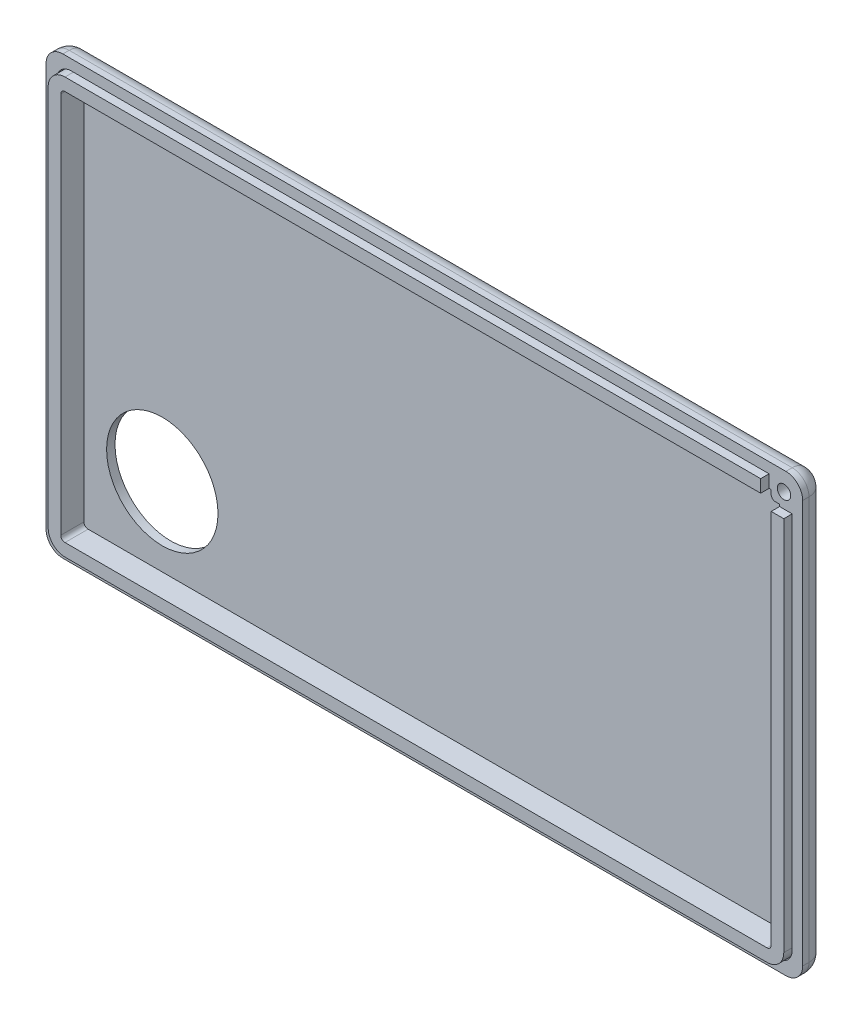
from build123d import *
from OCP.BRepFilletAPI import BRepFilletAPI_MakeChamfer

# Parameters (mm, degrees)
SKETCH1_W            = 180
SKETCH1_H            = 120
BOSS_EXTRUDE1_DEPTH  = 20
BOSS_EXTRUDE2_DEPTH  = 180
SHELL3_T             = -2
FILLET1_R            = 4
FILLET2_R            = 4
BOSS_EXTRUDE3_DEPTH  = 2.5
SKETCH14_R           = 1.6
CUT_EXTRUDE10_DEPTH  = 3.2
CUT_EXTRUDE3_REACH   = 151.991
SKETCH7_W            = 14
SKETCH7_H            = 9
SKETCH8_R            = 1.35
BOSS_EXTRUDE4_DEPTH  = 5
SKETCH8_3_W          = 97.5
SKETCH8_3_H          = 40.5
CUT_EXTRUDE4_DEPTH   = 5
SKETCH9_W            = 50.8
SKETCH9_H            = 19.5
CUT_EXTRUDE5_DEPTH   = 5
SKETCH10_R           = 2.525
CUT_EXTRUDE6_DEPTH   = 5
SKETCH11_R           = 6.125
CUT_EXTRUDE7_DEPTH   = 5
CUT_EXTRUDE8_DEPTH   = 5
FILLET4_R            = 1.5
SKETCH13_W           = 22
SKETCH13_H           = 10
CUT_EXTRUDE9_DEPTH   = 5
CHAMFER1_SIZE        = 9.330127019
CHAMFER1_SIZE_2      = 2.5
SKETCH15_W           = 9
SKETCH15_H           = 14
CUT_EXTRUDE11_DEPTH  = 3.2
SKETCH16_R           = 3.5
CUT_EXTRUDE12_DEPTH  = 3.2
SKETCH17_R           = 7
SKETCH17_R_2         = 6
BOSS_EXTRUDE5_DEPTH  = 0.5
FILLET7_R            = 0.5
CUT_EXTRUDE13_DEPTH  = 1
FILLET8_R            = 1
SKETCH19_W           = 7.5
SKETCH19_H           = 5.2
SKETCH19_W_2         = 6.5
SKETCH19_H_2         = 6.5
CUT_EXTRUDE14_DEPTH  = 1.2
BOSS_EXTRUDE6_START  = 4
BOSS_EXTRUDE6_DEPTH  = 4
BOSS_EXTRUDE7_START  = 2
BOSS_EXTRUDE7_DEPTH  = 2
FILLET9_R            = 4
CUT_EXTRUDE18_REACH  = 220.067
BOSS_EXTRUDE8_DEPTH  = 3.5
BOSS_EXTRUDE10_DEPTH = 5.5
BOSS_EXTRUDE12_START = -3.5
BOSS_EXTRUDE12_DEPTH = 3.5
CUT_EXTRUDE21_DEPTH  = 54
SKETCH31_R           = 1.6
CUT_EXTRUDE22_DEPTH  = 54
FILLET11_R           = 1
SKETCH32_R           = 13.25
CUT_EXTRUDE23_DEPTH  = 10


# Read off the part's stored shape, not the designer's step: Boss-Extrude12
with BuildPart() as part:
    # Sketch1 → Boss-Extrude1 (new body)
    with BuildSketch(Plane(origin=(0, 0, 0), x_dir=(1, 0, 0), z_dir=(0, 1, 0))):
        Rectangle(SKETCH1_W, SKETCH1_H)
    extrude(amount=BOSS_EXTRUDE1_DEPTH)

    # Sketch2 → Boss-Extrude2 (add)
    with BuildSketch(Plane.ZY.offset(90)):
        Polygon((60, 20), (-40, 103.909963118), (-60, 103.909963118), (-60, 20), align=None)
    extrude(amount=-BOSS_EXTRUDE2_DEPTH)

    # Shell3
    shell3_openings = [part.faces().sort_by_distance(p)[0] for p in [
        (0, 51.954981559, -60),
    ]]
    offset(amount=SHELL3_T, openings=shell3_openings, kind=Kind.INTERSECTION)

    # Fillet1
    fillet1_edges = [part.edges().sort_by_distance(p)[0] for p in [
        (0, 20, 60),
        (0, 103.909963118, -40),
        (-90, 61.954981559, 10),
        (-90, 103.909963118, -50),
        (90, 103.909963118, -50),
        (90, 61.954981559, 10),
        (0, 0, 60),
        (-90, 0, 0),
        (90, 0, 0),
        (90, 10, 60),
        (-90, 10, 60),
    ]]
    fillet(fillet1_edges, radius=FILLET1_R)

    # Fillet2
    fillet2_edges = [part.edges().sort_by_distance(p)[0] for p in [
        (88, 2, -1),
        (88, 101.909963118, -50.363970234),
        (88, 60.488673901, 8.636029766),
        (88, 10.533692342, 58),
        (-88, 2, -1),
        (-88, 60.488673901, 8.636029766),
        (-88, 101.909963118, -50.363970234),
        (0, 2, 58),
        (-88, 10.533692342, 58),
        (0, 101.909963118, -40.727940469),
        (0, 19.067384684, 58),
    ]]
    fillet(fillet2_edges, radius=FILLET2_R)

    # Sketch4 → Boss-Extrude3 (add)
    with BuildSketch(Plane(origin=(0, 2, 0), x_dir=(1, 0, 0), z_dir=(0, 1, 0))):
        Polygon((34.175426481, -3.50047313), (32.58771324, -0.75047313), (29.41228676, -0.75047313), (27.824573519, -3.50047313), (29.41228676, -6.25047313), (32.58771324, -6.25047313), align=None)
        Polygon((32.58771324, 41.24952687), (34.175426481, 38.49952687), (32.58771324, 35.74952687), (29.41228676, 35.74952687), (27.824573519, 38.49952687), (29.41228676, 41.24952687), align=None)
        Polygon((-29.41228676, 41.24952687), (-32.58771324, 41.24952687), (-34.175426481, 38.49952687), (-32.58771324, 35.74952687), (-29.41228676, 35.74952687), (-27.824573519, 38.49952687), align=None)
        Polygon((-32.58771324, -6.25047313), (-34.175426481, -3.50047313), (-32.58771324, -0.75047313), (-29.41228676, -0.75047313), (-27.824573519, -3.50047313), (-29.41228676, -6.25047313), align=None)
    extrude(amount=BOSS_EXTRUDE3_DEPTH)

    # Sketch14 → Cut-Extrude10 (cut)
    with BuildSketch(Plane(origin=(0, 4.5, 0), x_dir=(1, 0, 0), z_dir=(0, 1, 0))):
        with Locations(Location((31, 38.49952687, 0), (0, 0, 270))):
            Circle(SKETCH14_R)
        with Locations(Location((-31, -3.50047313, 0), (0, 0, 90))):
            Circle(SKETCH14_R)
        with Locations(Location((-31, 38.49952687, 0), (0, 0, 270))):
            Circle(SKETCH14_R)
        with Locations(Location((31, -3.50047313, 0), (0, 0, 270))):
            Circle(SKETCH14_R)
    extrude(amount=-CUT_EXTRUDE10_DEPTH, mode=Mode.SUBTRACT)

    # Sketch7 → Cut-Extrude3 (cut, up to next)
    with BuildSketch(Plane(origin=(0, 103.909963118, 0), x_dir=(1, 0, 0), z_dir=(0, 1, 0)), mode=Mode.PRIVATE) as cut_extrude3_sk1:
        with Locations((-63, 50.727940469)):
            Rectangle(SKETCH7_W, SKETCH7_H)
    cut_extrude3_tool1 = extrude(cut_extrude3_sk1.sketch, amount=-CUT_EXTRUDE3_REACH, mode=Mode.PRIVATE) & part.part
    add(cut_extrude3_tool1.solids().sort_by_distance((-63, 103.909963, -50.72794))[0], mode=Mode.SUBTRACT)

    # Sketch8 → Boss-Extrude4 (add)
    with BuildSketch(Plane(origin=(0, 41.280714367, 34.6386322), x_dir=(1, 0, 0), z_dir=(0, 0.766044443118982, 0.6427876096865347))):
        with Locations(Location((-73.5, 93.477933603, 0), (0, 0, 270))):
            Circle(SKETCH8_R)
        with Locations(Location((-73.5, 37.977933603, 0), (0, 0, 270))):
            Circle(SKETCH8_R)
        with Locations(Location((19, 37.977933603, 0), (0, 0, 270))):
            Circle(SKETCH8_R)
        with Locations(Location((19, 93.477933603, 0), (0, 0, 270))):
            Circle(SKETCH8_R)
    extrude(amount=-BOSS_EXTRUDE4_DEPTH)

    # Sketch8<3> → Cut-Extrude4 (cut)
    with BuildSketch(Plane(origin=(0, 41.280714367, 34.6386322), x_dir=(1, 0, 0), z_dir=(0, 0.766044443118982, 0.6427876096865347))):
        with Locations((-27.25, 65.727933603)):
            Rectangle(SKETCH8_3_W, SKETCH8_3_H)
    extrude(amount=-CUT_EXTRUDE4_DEPTH, mode=Mode.SUBTRACT)

    # Sketch9 → Cut-Extrude5 (cut)
    with BuildSketch(Plane(origin=(0, 41.280714367, 34.6386322), x_dir=(1, 0, 0), z_dir=(0, 0.766044443118982, 0.6427876096865347))):
        with Locations((-50.6, 20.727933603)):
            Rectangle(SKETCH9_W, SKETCH9_H)
    extrude(amount=-CUT_EXTRUDE5_DEPTH, mode=Mode.SUBTRACT)

    # Sketch10 → Cut-Extrude6 (cut)
    with BuildSketch(Plane(origin=(0, 41.280714367, 34.6386322), x_dir=(1, 0, 0), z_dir=(0, 0.766044443118982, 0.6427876096865347))):
        with Locations(Location((-13.525, 20.727933603, 0), (0, 0, 270))):
            Circle(SKETCH10_R)
        with Locations(Location((-1.85, 20.727933603, 0), (0, 0, 270))):
            Circle(SKETCH10_R)
        with Locations(Location((9.825, 20.727933603, 0), (0, 0, 270))):
            Circle(SKETCH10_R)
    extrude(amount=-CUT_EXTRUDE6_DEPTH, mode=Mode.SUBTRACT)

    # Sketch11 → Cut-Extrude7 (cut)
    with BuildSketch(Plane(origin=(0, 41.280714367, 34.6386322), x_dir=(1, 0, 0), z_dir=(0, 0.766044443118982, 0.6427876096865347))):
        with Locations(Location((37.625, 60.977933603, 0), (0, 0, 270))):
            Circle(SKETCH11_R)
        with BuildLine():
            ThreePointArc((76, 60.977933603), (74.206029035, 65.308962638), (69.875, 67.102933603))
            Line((69.875, 67.102933603), (69.875, 54.852933603))
            ThreePointArc((69.875, 54.852933603), (74.206029035, 56.646904568), (76, 60.977933603))
        make_face()
        with BuildLine():
            Line((69.875, 54.852933603), (69.875, 67.102933603))
            ThreePointArc((69.875, 67.102933603), (63.75, 60.977933603), (69.875, 54.852933603))
        make_face()
    extrude(amount=-CUT_EXTRUDE7_DEPTH, mode=Mode.SUBTRACT)

    # Sketch12 → Cut-Extrude8 (cut)
    with BuildSketch(Plane(origin=(0, 41.280714367, 34.6386322), x_dir=(1, 0, 0), z_dir=(0, 0.766044443118982, 0.6427876096865347))):
        with BuildLine():
            ThreePointArc((-76, -10.131875079), (-66, -20.131875079), (-56, -10.131875079))
            Line((-56, -10.131875079), (-76, -10.131875079))
        make_face()
        with BuildLine():
            Line((-76, -10.131875079), (-56, -10.131875079))
            ThreePointArc((-56, -10.131875079), (-66, -0.131875079), (-76, -10.131875079))
        make_face()
        with BuildLine():
            ThreePointArc((-25.2, -10.131875079), (-35.2, -0.131875079), (-45.2, -10.131875079))
            Line((-45.2, -10.131875079), (-25.2, -10.131875079))
        make_face()
        with BuildLine():
            Line((-25.2, -10.131875079), (-45.2, -10.131875079))
            ThreePointArc((-45.2, -10.131875079), (-35.2, -20.131875079), (-25.2, -10.131875079))
        make_face()
    extrude(amount=-CUT_EXTRUDE8_DEPTH, mode=Mode.SUBTRACT)

    # Fillet4
    fillet4_edges = [part.edges().sort_by_distance(p)[0] for p in [
        (-45.2, 33.235981717, 41.114523583),
        (-76, 33.235981717, 41.114523583),
    ]]
    fillet(fillet4_edges, radius=FILLET4_R)

    # Sketch13 → Cut-Extrude9 (cut)
    with BuildSketch(Plane(origin=(0, 41.280714367, 34.6386322), x_dir=(1, 0, 0), z_dir=(0, 0.766044443118982, 0.6427876096865347))):
        with Locations((-1.85, -0.131875079)):
            Rectangle(SKETCH13_W, SKETCH13_H)
        with Locations((-1.85, -20.131875079)):
            Rectangle(SKETCH13_W, SKETCH13_H)
    extrude(amount=-CUT_EXTRUDE9_DEPTH, mode=Mode.SUBTRACT)

    # Chamfer1
    chamfer1_edges_1 = [part.edges().sort_by_distance(p)[0] for p in [
        (-28.61843014, 2, 4.87547313),
    ]]
    chamfer1_side_1 = [part.faces().sort_by_distance(p)[0] for p in [
        (-28.575128869, 2, 4.90047313),
    ]]
    chamfer1_edges_2 = [part.edges().sort_by_distance(p)[0] for p in [
        (-31, 2, 6.25047313),
    ]]
    chamfer1_side_2 = [part.faces().sort_by_distance(p)[0] for p in [
        (-31, 2, 6.30047313),
    ]]
    chamfer1_edges_3 = [part.edges().sort_by_distance(p)[0] for p in [
        (-33.38156986, 2, 4.87547313),
    ]]
    chamfer1_side_3 = [part.faces().sort_by_distance(p)[0] for p in [
        (-33.424871131, 2, 4.90047313),
    ]]
    chamfer1_edges_4 = [part.edges().sort_by_distance(p)[0] for p in [
        (-33.38156986, 2, -37.12452687),
    ]]
    chamfer1_side_4 = [part.faces().sort_by_distance(p)[0] for p in [
        (-33.424871131, 2, -37.09952687),
    ]]
    chamfer1_edges_5 = [part.edges().sort_by_distance(p)[0] for p in [
        (-31, 2, -35.74952687),
    ]]
    chamfer1_side_5 = [part.faces().sort_by_distance(p)[0] for p in [
        (-31, 2, -35.69952687),
    ]]
    chamfer1_edges_6 = [part.edges().sort_by_distance(p)[0] for p in [
        (-28.61843014, 2, -37.12452687),
    ]]
    chamfer1_side_6 = [part.faces().sort_by_distance(p)[0] for p in [
        (-28.575128869, 2, -37.09952687),
    ]]
    chamfer1_edges_7 = [part.edges().sort_by_distance(p)[0] for p in [
        (28.61843014, 2, -37.12452687),
    ]]
    chamfer1_side_7 = [part.faces().sort_by_distance(p)[0] for p in [
        (28.575128869, 2, -37.09952687),
    ]]
    chamfer1_edges_8 = [part.edges().sort_by_distance(p)[0] for p in [
        (31, 2, -35.74952687),
    ]]
    chamfer1_side_8 = [part.faces().sort_by_distance(p)[0] for p in [
        (31, 2, -35.69952687),
    ]]
    chamfer1_edges_9 = [part.edges().sort_by_distance(p)[0] for p in [
        (33.38156986, 2, -37.12452687),
    ]]
    chamfer1_side_9 = [part.faces().sort_by_distance(p)[0] for p in [
        (33.424871131, 2, -37.09952687),
    ]]
    chamfer1_edges_10 = [part.edges().sort_by_distance(p)[0] for p in [
        (33.38156986, 2, 4.87547313),
    ]]
    chamfer1_side_10 = [part.faces().sort_by_distance(p)[0] for p in [
        (33.424871131, 2, 4.90047313),
    ]]
    chamfer1_edges_11 = [part.edges().sort_by_distance(p)[0] for p in [
        (28.61843014, 2, 4.87547313),
    ]]
    chamfer1_side_11 = [part.faces().sort_by_distance(p)[0] for p in [
        (28.575128869, 2, 4.90047313),
    ]]
    chamfer1_edges_12 = [part.edges().sort_by_distance(p)[0] for p in [
        (31, 2, 6.25047313),
    ]]
    chamfer1_side_12 = [part.faces().sort_by_distance(p)[0] for p in [
        (31, 2, 6.30047313),
    ]]
    chamfer1 = BRepFilletAPI_MakeChamfer(part.part.solid().wrapped)
    for e in chamfer1_edges_1:
        chamfer1.Add(CHAMFER1_SIZE - 0.0001, CHAMFER1_SIZE_2 - 0.0001, e.wrapped, chamfer1_side_1[0].wrapped)
    for e in chamfer1_edges_2:
        chamfer1.Add(CHAMFER1_SIZE - 0.0001, CHAMFER1_SIZE_2 - 0.0001, e.wrapped, chamfer1_side_2[0].wrapped)
    for e in chamfer1_edges_3:
        chamfer1.Add(CHAMFER1_SIZE - 0.0001, CHAMFER1_SIZE_2 - 0.0001, e.wrapped, chamfer1_side_3[0].wrapped)
    for e in chamfer1_edges_4:
        chamfer1.Add(CHAMFER1_SIZE - 0.0001, CHAMFER1_SIZE_2 - 0.0001, e.wrapped, chamfer1_side_4[0].wrapped)
    for e in chamfer1_edges_5:
        chamfer1.Add(CHAMFER1_SIZE - 0.0001, CHAMFER1_SIZE_2 - 0.0001, e.wrapped, chamfer1_side_5[0].wrapped)
    for e in chamfer1_edges_6:
        chamfer1.Add(CHAMFER1_SIZE - 0.0001, CHAMFER1_SIZE_2 - 0.0001, e.wrapped, chamfer1_side_6[0].wrapped)
    for e in chamfer1_edges_7:
        chamfer1.Add(CHAMFER1_SIZE - 0.0001, CHAMFER1_SIZE_2 - 0.0001, e.wrapped, chamfer1_side_7[0].wrapped)
    for e in chamfer1_edges_8:
        chamfer1.Add(CHAMFER1_SIZE - 0.0001, CHAMFER1_SIZE_2 - 0.0001, e.wrapped, chamfer1_side_8[0].wrapped)
    for e in chamfer1_edges_9:
        chamfer1.Add(CHAMFER1_SIZE - 0.0001, CHAMFER1_SIZE_2 - 0.0001, e.wrapped, chamfer1_side_9[0].wrapped)
    for e in chamfer1_edges_10:
        chamfer1.Add(CHAMFER1_SIZE - 0.0001, CHAMFER1_SIZE_2 - 0.0001, e.wrapped, chamfer1_side_10[0].wrapped)
    for e in chamfer1_edges_11:
        chamfer1.Add(CHAMFER1_SIZE - 0.0001, CHAMFER1_SIZE_2 - 0.0001, e.wrapped, chamfer1_side_11[0].wrapped)
    for e in chamfer1_edges_12:
        chamfer1.Add(CHAMFER1_SIZE - 0.0001, CHAMFER1_SIZE_2 - 0.0001, e.wrapped, chamfer1_side_12[0].wrapped)
    add(Compound.cast(chamfer1.Shape()), mode=Mode.REPLACE)  # a hair under: the kernel refuses the full size

    # Sketch15 → Cut-Extrude11 (cut)
    with BuildSketch(Plane(origin=(0, 41.280714367, 34.6386322), x_dir=(1, 0, 0), z_dir=(0, 0.766044443118982, 0.6427876096865347))):
        with Locations((69.812284425, 22.683898911)):
            Rectangle(SKETCH15_W, SKETCH15_H)
        with Locations((53.870194494, 22.738966801)):
            Rectangle(SKETCH15_W, SKETCH15_H)
        with Locations((37.689197041, 22.832961961)):
            Rectangle(SKETCH15_W, SKETCH15_H)
    extrude(amount=-CUT_EXTRUDE11_DEPTH, mode=Mode.SUBTRACT)

    # Sketch16 → Cut-Extrude12 (cut)
    with BuildSketch(Plane(origin=(0, 41.280714367, 34.6386322), x_dir=(1, 0, 0), z_dir=(0, 0.766044443118982, 0.6427876096865347))):
        with Locations(Location((66.7875, -10.131875079, 0), (0, 0, 270))):
            Circle(SKETCH16_R)
        with Locations(Location((28.150317304, -10.131875079, 0), (0, 0, 270))):
            Circle(SKETCH16_R)
        with Locations(Location((47.575, -10.131875079, 0), (0, 0, 270))):
            Circle(SKETCH16_R)
    extrude(amount=-CUT_EXTRUDE12_DEPTH, mode=Mode.SUBTRACT)

    # Sketch17 → Boss-Extrude5 (add)
    # profile 1 of 4: a face of its own
    with BuildSketch(Plane.XZ):
        with Locations(Location((-78.221825407, 48.221825407, 0), (0, 0, 270))):
            Circle(SKETCH17_R)
        with Locations(Location((-78.221825407, 48.221825407, 0), (0, 0, 270))):
            Circle(SKETCH17_R_2, mode=Mode.SUBTRACT)
    # profile 2 of 4: a face of its own
    with BuildSketch(Plane.XZ):
        with Locations(Location((78.221825407, 48.221825407, 0), (0, 0, 270))):
            Circle(SKETCH17_R)
        with Locations(Location((78.221825407, 48.221825407, 0), (0, 0, 270))):
            Circle(SKETCH17_R_2, mode=Mode.SUBTRACT)
    # profile 3 of 4: a face of its own
    with BuildSketch(Plane.XZ):
        with Locations(Location((78.221825407, -51.278809632, 0), (0, 0, 270))):
            Circle(SKETCH17_R)
        with Locations(Location((78.221825407, -51.278809632, 0), (0, 0, 270))):
            Circle(SKETCH17_R_2, mode=Mode.SUBTRACT)
    # profile 4 of 4: a face of its own
    with BuildSketch(Plane.XZ):
        with Locations(Location((-78.221825407, -51.278809632, 0), (0, 0, 270))):
            Circle(SKETCH17_R)
        with Locations(Location((-78.221825407, -51.278809632, 0), (0, 0, 270))):
            Circle(SKETCH17_R_2, mode=Mode.SUBTRACT)
    extrude(amount=BOSS_EXTRUDE5_DEPTH)

    # Fillet7
    fillet7_edges = [part.edges().sort_by_distance(p)[0] for p in [
        (78.221825407, -0.5, -45.278809632),
        (78.221825407, -0.5, -44.278809632),
        (78.221825407, -0.5, 55.221825407),
        (78.221825407, -0.5, 54.221825407),
        (-78.221825407, -0.5, 54.221825407),
        (-78.221825407, -0.5, 55.221825407),
        (-78.221825407, -0.5, -44.278809632),
        (-78.221825407, -0.5, -45.278809632),
    ]]
    fillet(fillet7_edges, radius=FILLET7_R - 0.0001)  # a hair under: the kernel refuses the full size

    # Sketch18 → Cut-Extrude13 (cut)
    with BuildSketch(Plane.XZ.offset(-101.909963118)):
        Polygon((-51, -58), (79, -58), (79, -44.183821406), (-51, -44.183821406), (-51, -50.727940469), align=None)
    extrude(amount=-CUT_EXTRUDE13_DEPTH, mode=Mode.SUBTRACT)

    # Fillet8
    fillet8_edges = [part.edges().sort_by_distance(p)[0] for p in [
        (-51, 102.909963118, -51.091910703),
        (14, 102.909963118, -44.183821406),
        (79, 102.909963118, -51.091910703),
        (14, 102.909963118, -58),
    ]]
    fillet(fillet8_edges, radius=FILLET8_R - 0.0001)  # a hair under: the kernel refuses the full size

    # Sketch19 → Cut-Extrude14 (cut)
    with BuildSketch(Plane(origin=(0, 103.909963118, 0), x_dir=(1, 0, 0), z_dir=(0, 1, 0))):
        with Locations((-42.25, 50.727940469)):
            Rectangle(SKETCH19_W, SKETCH19_H)
        with Locations((-32.25, 50.727940469)):
            Rectangle(SKETCH19_W_2, SKETCH19_H_2)
        Polygon((-14, 50.727940469), (-14, 53.227940469), (74.4, 53.227940469), (74.4, 48.227940469), (-14, 48.227940469), align=None)
    extrude(amount=-CUT_EXTRUDE14_DEPTH, mode=Mode.SUBTRACT)

    # Sketch20 → Boss-Extrude6 (add)
    with BuildSketch(Plane(origin=(0, 0, -60), x_dir=(-1, 0, 0), z_dir=(0, 0, -1)).offset(BOSS_EXTRUDE6_START)):
        with BuildLine():
            Line((-86, 103.909963118), (86, 103.909963118))
            ThreePointArc((86, 103.909963118), (88.828427125, 102.738390242), (90, 99.909963118))
            Line((90, 99.909963118), (90, 4))
            ThreePointArc((90, 4), (88.828427125, 1.171572875), (86, 0))
            Line((86, 0), (-86, 0))
            ThreePointArc((-86, 0), (-88.828427125, 1.171572875), (-90, 4))
            Line((-90, 4), (-90, 99.909963118))
            ThreePointArc((-90, 99.909963118), (-88.828427125, 102.738390242), (-86, 103.909963118))
        make_face()
        with BuildLine():
            Line((-88, 97.909963118), (-88, 6))
            ThreePointArc((-88, 6), (-86.828427125, 3.171572875), (-84, 2))
            Line((-84, 2), (84, 2))
            ThreePointArc((84, 2), (86.828427125, 3.171572875), (88, 6))
            Line((88, 6), (88, 97.909963118))
            ThreePointArc((88, 97.909963118), (86.828427125, 100.738390242), (84, 101.909963118))
            Line((84, 101.909963118), (-84, 101.909963118))
            ThreePointArc((-84, 101.909963118), (-86.828427125, 100.738390242), (-88, 97.909963118))
        make_face(mode=Mode.SUBTRACT)
    extrude(amount=-BOSS_EXTRUDE6_DEPTH)

    # Sketch23 → Boss-Extrude7 (add)
    with BuildSketch(Plane(origin=(0, 0, -64), x_dir=(-1, 0, 0), z_dir=(0, 0, -1)).offset(BOSS_EXTRUDE7_START)):
        with BuildLine():
            Line((-86, 103.909963118), (86, 103.909963118))
            ThreePointArc((86, 103.909963118), (88.828427125, 102.738390242), (90, 99.909963118))
            Line((90, 99.909963118), (90, 4))
            ThreePointArc((90, 4), (88.828427125, 1.171572875), (86, 0))
            Line((86, 0), (-86, 0))
            ThreePointArc((-86, 0), (-88.828427125, 1.171572875), (-90, 4))
            Line((-90, 4), (-90, 99.909963118))
            ThreePointArc((-90, 99.909963118), (-88.828427125, 102.738390242), (-86, 103.909963118))
        make_face()
    extrude(amount=-BOSS_EXTRUDE7_DEPTH)

    # Fillet9
    fillet9_edges = [part.edges().sort_by_distance(p)[0] for p in [
        (88.828427125, 102.738390242, -66),
        (90, 51.954981559, -66),
        (88.828427125, 1.171572875, -66),
        (0, 0, -66),
        (-88.828427125, 1.171572875, -66),
        (-90, 51.954981559, -66),
        (-88.828427125, 102.738390242, -66),
        (0, 103.909963118, -66),
    ]]
    fillet(fillet9_edges, radius=FILLET9_R)

    # Cut-Extrude18: up to this face of the body (flat: up to its plane)
    cut_extrude18_end = Plane(part.part.faces().sort_by_distance((-90, 40.707947671, -17.408745232))[0])
    # Sketch25 → Cut-Extrude18 (cut, up to the picked face)
    with BuildSketch(Plane(origin=(90, 0, 0), x_dir=(0, 0, -1), z_dir=(1, 0, 0)), mode=Mode.PRIVATE) as cut_extrude18_sk1:
        Polygon((60.5, 103.909963118), (41.455880937, 103.909963118), (38.505766569, 103.909963118), (38.884730498, 102.97414089), (-58.571150439, 21.19894714), (-60.532827399, 20.404560357), (-60, 18.134769367), (-60, 4), (-60.2664137, 0), (-56.570989921, -1.575749733), (-39.460910692, -1.575749733), (-38.789002037, 0), (46.546103456, -2.451826891), (60.5, -1.899548411), (60.5, 0.282012763), align=None)
    cut_extrude18_tool1 = split(extrude(cut_extrude18_sk1.sketch, amount=-CUT_EXTRUDE18_REACH, mode=Mode.PRIVATE), bisect_by=cut_extrude18_end, keep=Keep.BOTH, mode=Mode.PRIVATE)
    add(cut_extrude18_tool1.solids().sort_by(Axis((90, 39.075645, -13.771373), (-1, 0, 0)))[0], mode=Mode.SUBTRACT)

    # Sketch26 → Boss-Extrude8 (add)
    with BuildSketch(Plane.XY.offset(-64)):
        with BuildLine():
            Line((-88, 97.909963118), (-88, 6))
            ThreePointArc((-88, 6), (-86.828427125, 3.171572875), (-84, 2))
            Line((-84, 2), (84, 2))
            ThreePointArc((84, 2), (86.828427125, 3.171572875), (88, 6))
            Line((88, 6), (88, 97.909963118))
            ThreePointArc((88, 97.909963118), (86.828427125, 100.738390242), (84, 101.909963118))
            Line((84, 101.909963118), (-84, 101.909963118))
            ThreePointArc((-84, 101.909963118), (-86.828427125, 100.738390242), (-88, 97.909963118))
        make_face()
        with BuildLine():
            Line((84, 101.409963118), (-84, 101.409963118))
            ThreePointArc((-84, 101.409963118), (-86.474873734, 100.384836852), (-87.5, 97.909963118))
            Line((-87.5, 97.909963118), (-87.5, 6))
            ThreePointArc((-87.5, 6), (-86.474873734, 3.525126266), (-84, 2.5))
            Line((-84, 2.5), (84, 2.5))
            ThreePointArc((84, 2.5), (86.474873734, 3.525126266), (87.5, 6))
            Line((87.5, 6), (87.5, 97.909963118))
            ThreePointArc((87.5, 97.909963118), (86.474873734, 100.384836852), (84, 101.409963118))
        make_face(mode=Mode.SUBTRACT)
    extrude(amount=BOSS_EXTRUDE8_DEPTH)

    # Sketch27 → Boss-Extrude10 (add)
    with BuildSketch(Plane.XY.offset(-64)):
        with BuildLine():
            Line((-87.5, 97.409963118), (-87.5, 6.5))
            ThreePointArc((-87.5, 6.5), (-86.328427125, 3.671572875), (-83.5, 2.5))
            Line((-83.5, 2.5), (83.498076121, 2.5))
            ThreePointArc((83.498076121, 2.5), (86.327863634, 3.672136366), (87.5, 6.501923879))
            Line((87.5, 6.501923879), (87.5, 97.409963118))
            ThreePointArc((87.5, 97.409963118), (86.328427125, 100.238390242), (83.5, 101.409963118))
            Line((83.5, 101.409963118), (-83.5, 101.409963118))
            ThreePointArc((-83.5, 101.409963118), (-86.328427125, 100.238390242), (-87.5, 97.409963118))
        make_face()
        with BuildLine():
            Line((83.5, 98.409963118), (-83.5, 98.409963118))
            ThreePointArc((-83.5, 98.409963118), (-84.207106781, 98.117069899), (-84.5, 97.409963118))
            Line((-84.5, 97.409963118), (-84.5, 6.5))
            ThreePointArc((-84.5, 6.5), (-84.207106781, 5.792893219), (-83.5, 5.5))
            Line((-83.5, 5.5), (83.498076121, 5.5))
            ThreePointArc((83.498076121, 5.5), (84.20654329, 5.79345671), (84.5, 6.501923879))
            Line((84.5, 6.501923879), (84.5, 97.409963118))
            ThreePointArc((84.5, 97.409963118), (84.207106781, 98.117069899), (83.5, 98.409963118))
        make_face(mode=Mode.SUBTRACT)
    extrude(amount=BOSS_EXTRUDE10_DEPTH)

    # Boss-Extrude12 outline → Boss-Extrude12 (add)
    with BuildSketch(Plane.XY.offset(-60.5).offset(BOSS_EXTRUDE12_START)):
        with BuildLine():
            Line((82.5, 98.409963118), (82.5, 96.409963118))
            Line((82.5, 96.409963118), (84.5, 96.409963118))
            Line((84.5, 96.409963118), (84.5, 97.409963118))
            ThreePointArc((84.5, 97.409963118), (84.207106781, 98.117069899), (83.5, 98.409963118))
            Line((83.5, 98.409963118), (82.5, 98.409963118))
        make_face()
        with BuildLine():
            Line((84, 101.409963118), (83.5, 101.409963118))
            ThreePointArc((83.5, 101.409963118), (86.328427125, 100.238390242), (87.5, 97.409963118))
            Line((87.5, 97.409963118), (87.5, 97.909963118))
            ThreePointArc((87.5, 97.909963118), (86.474873734, 100.384836852), (84, 101.409963118))
        make_face()
    extrude(amount=BOSS_EXTRUDE12_DEPTH)

    # Sketch30 → Cut-Extrude21 (cut)
    with BuildSketch(Plane.XY.offset(-60.5)):
        Polygon((82.5, 96.409963118), (82.5, 98.409963118), (82, 98.409963118), (82, 104.702751436), (91.573615081, 104.702751436), (91.845206998, 95.909963118), (87.5, 95.909963118), (84.5, 95.909963118), (84.5, 96.409963118), align=None)
    extrude(amount=CUT_EXTRUDE21_DEPTH, mode=Mode.SUBTRACT)

    # Sketch31 → Cut-Extrude22 (cut)
    with BuildSketch(Plane.XY.offset(-60.5)):
        with Locations((85.55, 99.459963118)):
            Circle(SKETCH31_R)
    extrude(amount=-CUT_EXTRUDE22_DEPTH, mode=Mode.SUBTRACT)

    # Fillet11
    fillet11_edges = [part.edges().sort_by_distance(p)[0] for p in [
        (82.5, 96.409963118, -62.25),
    ]]
    fillet(fillet11_edges, radius=FILLET11_R)

    # Sketch32 → Cut-Extrude23 (cut)
    with BuildSketch(Plane(origin=(0, 0, -66), x_dir=(-1, 0, 0), z_dir=(0, 0, -1))):
        with Locations((65.847456736, 24.152543264)):
            Circle(SKETCH32_R)
    extrude(amount=-CUT_EXTRUDE23_DEPTH, mode=Mode.SUBTRACT)


solid = part.part
